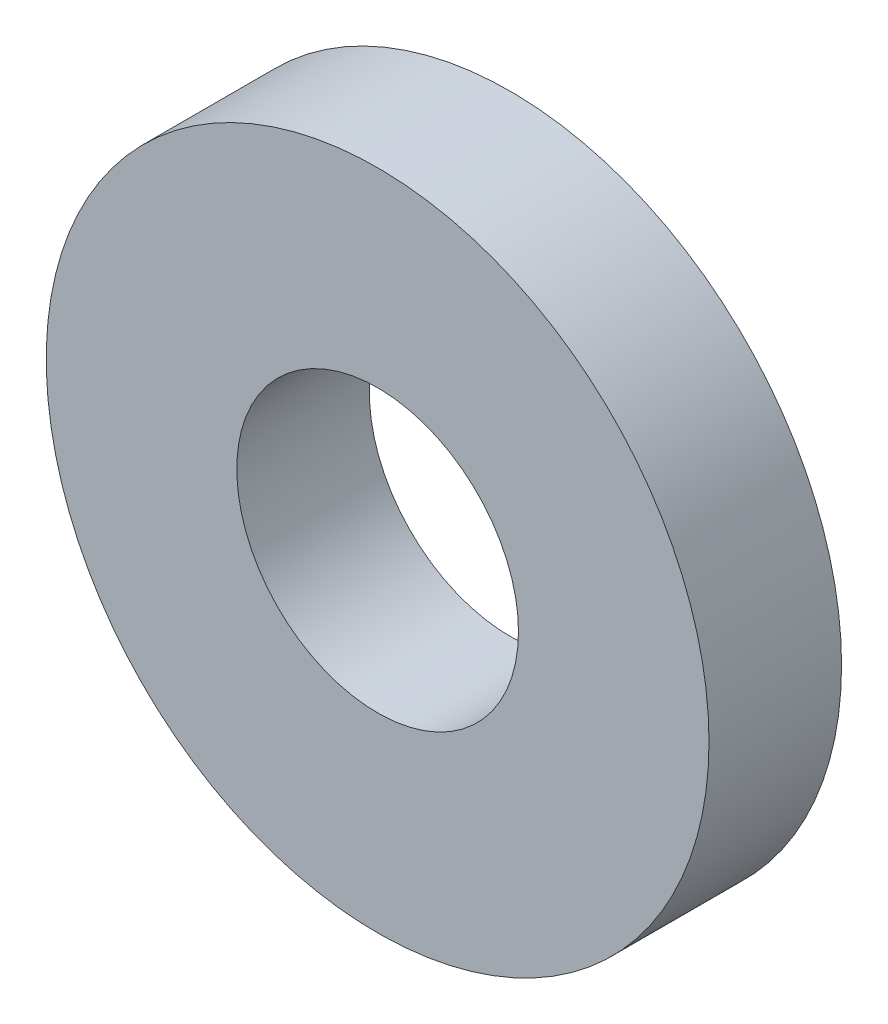
from build123d import *

# Parameters (mm, degrees)
IZIM1_R            = 10
IZIM1_R_2          = 4.25
TABAN_FLAN_1_DEPTH = 4


# Sheet-metal steps are written as plain solids
with BuildPart() as part:
    # Çizim1 → Taban-Flanş1 (new body)
    with BuildSketch(Plane.XY):
        Circle(IZIM1_R)
        Circle(IZIM1_R_2, mode=Mode.SUBTRACT)
    extrude(amount=-TABAN_FLAN_1_DEPTH)


solid = part.part
